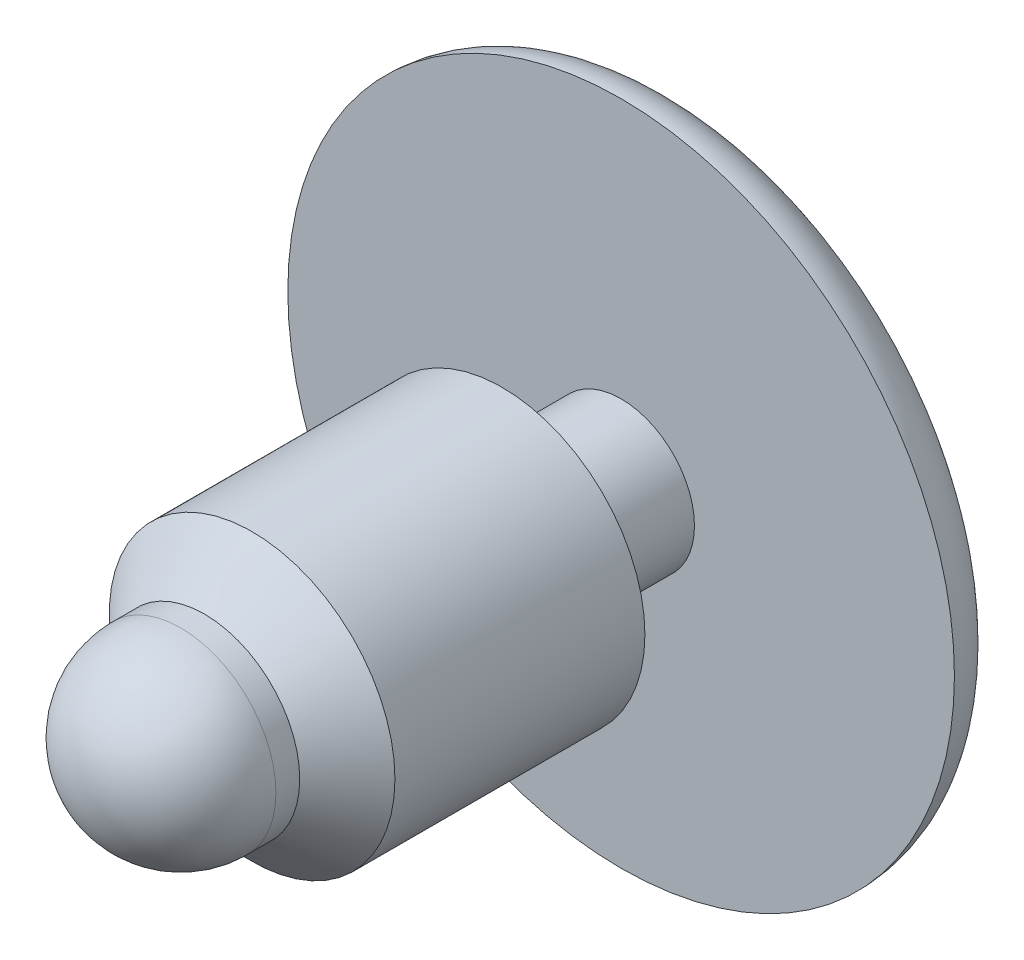
from build123d import *

# Parameters (mm, degrees)
SKETCH1_R      = 8.89
EXTRUDE1_DEPTH = 1.524
SKETCH2_R      = 1.9558
EXTRUDE2_DEPTH = 3.175
SKETCH3_R      = 3.81
EXTRUDE3_DEPTH = 7.9375
SKETCH4_R      = 2.54
EXTRUDE4_DEPTH = 3.175
FILLET1_R      = 2.54
CHAMFER4_SIZE  = 1.27
FILLET2_R      = 1.524


with BuildPart() as part:
    # Sketch1 → Extrude1 (new body)
    with BuildSketch(Plane.XY):
        Circle(SKETCH1_R)
    extrude(amount=EXTRUDE1_DEPTH)

    # Sketch2 → Extrude2 (add)
    with BuildSketch(Plane.XY.offset(1.524)):
        Circle(SKETCH2_R)
    extrude(amount=EXTRUDE2_DEPTH)

    # Sketch3 → Extrude3 (add)
    with BuildSketch(Plane.XY.offset(4.699)):
        Circle(SKETCH3_R)
    extrude(amount=EXTRUDE3_DEPTH)

    # Sketch4 → Extrude4 (add)
    with BuildSketch(Plane.XY.offset(12.6365)):
        with Locations(Location((0, 0, 0), (0, 0, 180))):
            Circle(SKETCH4_R)
    extrude(amount=EXTRUDE4_DEPTH)

    # Fillet1
    fillet1_edges = [part.edges().sort_by_distance(p)[0] for p in [
        (2.54, 0, 15.8115),
    ]]
    fillet(fillet1_edges, radius=FILLET1_R)

    # Chamfer4
    chamfer4_edges = [part.edges().sort_by_distance(p)[0] for p in [
        (-3.81, 0, 12.6365),
    ]]
    chamfer(chamfer4_edges, length=CHAMFER4_SIZE - 0.0001)  # a hair under: the kernel refuses the full size

    # Fillet2
    fillet2_edges = [part.edges().sort_by_distance(p)[0] for p in [
        (-8.89, 0, 0),
    ]]
    fillet(fillet2_edges, radius=FILLET2_R - 0.0001)  # a hair under: the kernel refuses the full size


solid = part.part
